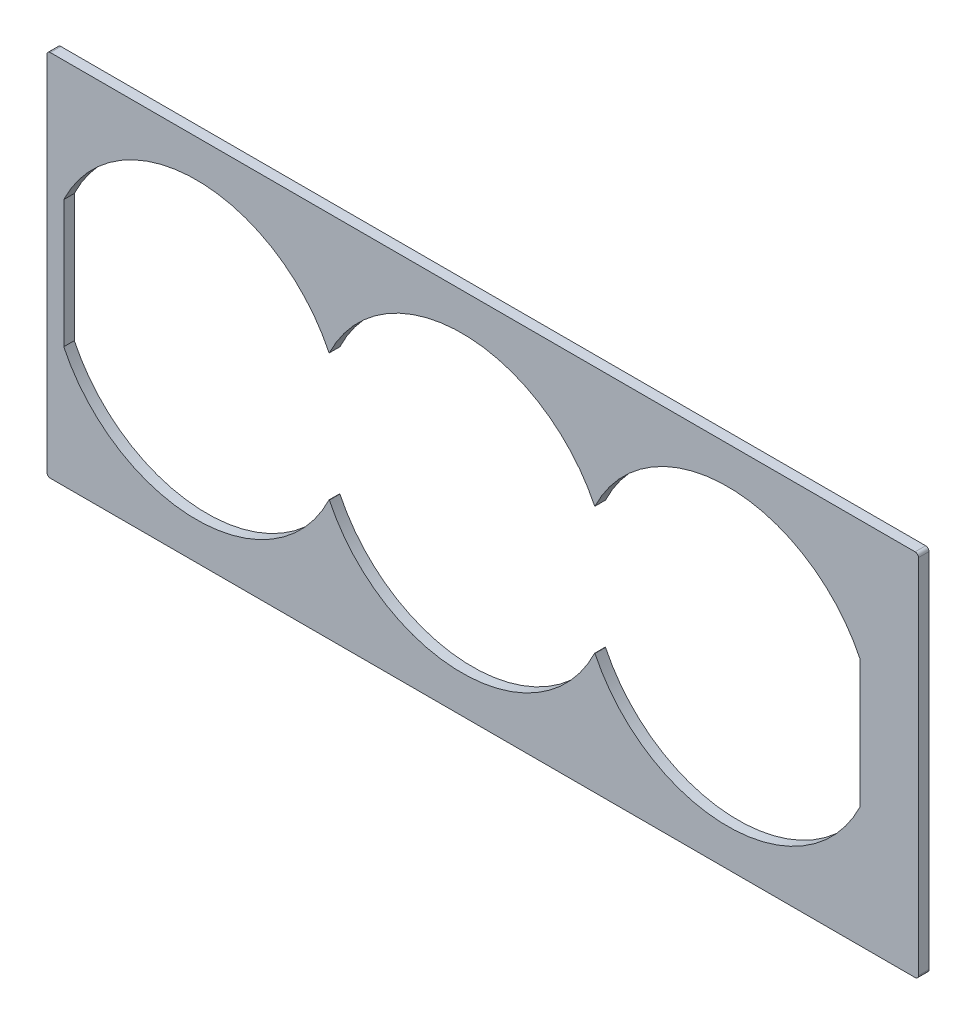
from build123d import *

# Parameters (mm, degrees)
SKETCH4_W                                = 330.2
SKETCH4_H                                = 139.7
DIMENSIONS_CONTROL_OPTICS_LOCATION_DEPTH = 4
FILLET1_R                                = 1.27


with BuildPart() as part:
    # Sketch4 → DIMENSIONS CONTROL OPTICS LOCATION (new body)
    with BuildSketch(Plane.XY):
        with Locations((165.1, 69.85)):
            Rectangle(SKETCH4_W, SKETCH4_H)
        with BuildLine():
            Line((6.35, 93.996304065), (6.35, 45.703695935))
            ThreePointArc((6.35, 45.703695935), (56.604, 14.096), (106.858, 45.703695935))
            Line((106.858, 45.703695935), (106.985, 45.703695935))
            ThreePointArc((106.985, 45.703695935), (157.239, 14.096), (207.493, 45.703695935))
            Line((207.493, 45.703695935), (207.62, 45.703695935))
            ThreePointArc((207.62, 45.703695935), (257.874, 14.096), (308.128, 45.703695935))
            Line((308.128, 45.703695935), (308.128, 93.996304065))
            ThreePointArc((308.128, 93.996304065), (257.874, 125.604), (207.62, 93.996304065))
            Line((207.62, 93.996304065), (207.493, 93.996304065))
            ThreePointArc((207.493, 93.996304065), (157.239, 125.604), (106.985, 93.996304065))
            Line((106.985, 93.996304065), (106.858, 93.996304065))
            ThreePointArc((106.858, 93.996304065), (56.604, 125.604), (6.35, 93.996304065))
        make_face(mode=Mode.SUBTRACT)
    extrude(amount=DIMENSIONS_CONTROL_OPTICS_LOCATION_DEPTH)

    # Fillet1
    fillet1_edges = [part.edges().sort_by_distance(p)[0] for p in [
        (330.2, 139.7, 2),
        (0, 0, 2),
        (0, 139.7, 2),
        (330.2, 0, 2),
    ]]
    fillet(fillet1_edges, radius=FILLET1_R)


solid = part.part
